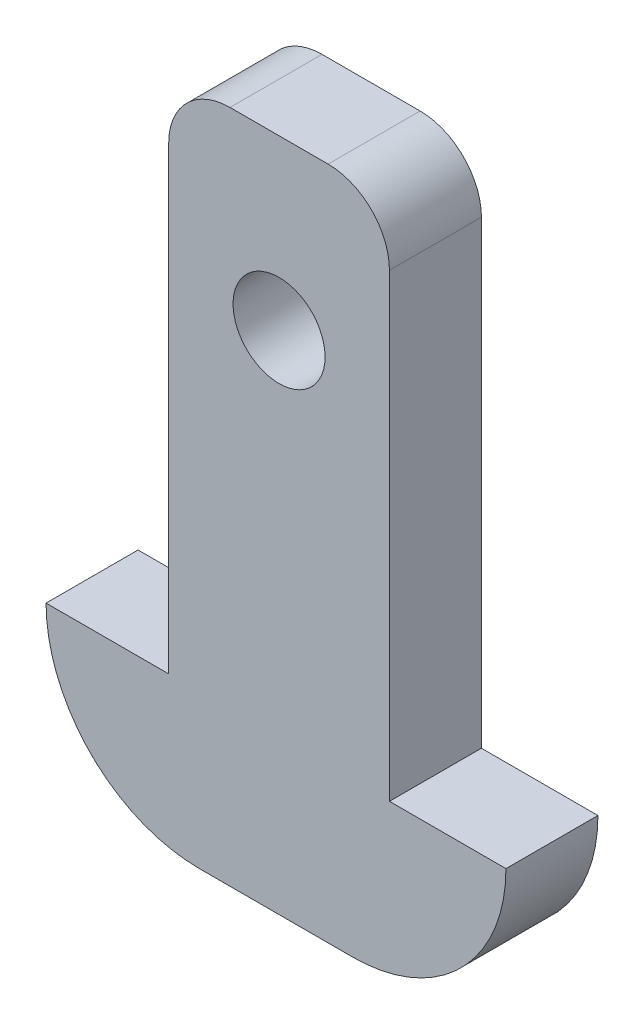
from build123d import *

# Parameters (mm, degrees)
RESSALTO_EXTRUS_O1_DEPTH = 3
ESBO_O2_R                = 1.5
CORTE_EXTRUS_O1_DEPTH    = 23.869193252
FILETE1_R                = 5
FILETE2_R                = 2


with BuildPart() as part:
    # Esboço1 → Ressalto-extrusão1 (new body)
    with BuildSketch(Plane.XY):
        Polygon((0, 0), (4, 0), (4, 17), (11.2, 17), (11.2, 0), (15, 0), (15, -5), (0, -5), align=None)
    extrude(amount=RESSALTO_EXTRUS_O1_DEPTH)

    # Esboço2 → Corte-extrusão1 (cut, through all)
    with BuildSketch(Plane.XY.offset(3)):
        with Locations((7.6, 11.5)):
            Circle(ESBO_O2_R)
    extrude(amount=-CORTE_EXTRUS_O1_DEPTH, mode=Mode.SUBTRACT)

    # Filete1
    filete1_edges = [part.edges().sort_by_distance(p)[0] for p in [
        (0, -5, 1.5),
        (15, -5, 1.5),
    ]]
    fillet(filete1_edges, radius=FILETE1_R - 0.0001)  # a hair under: the kernel refuses the full size

    # Filete2
    filete2_edges = [part.edges().sort_by_distance(p)[0] for p in [
        (4, 17, 1.5),
        (11.2, 17, 1.5),
    ]]
    fillet(filete2_edges, radius=FILETE2_R)


solid = part.part
